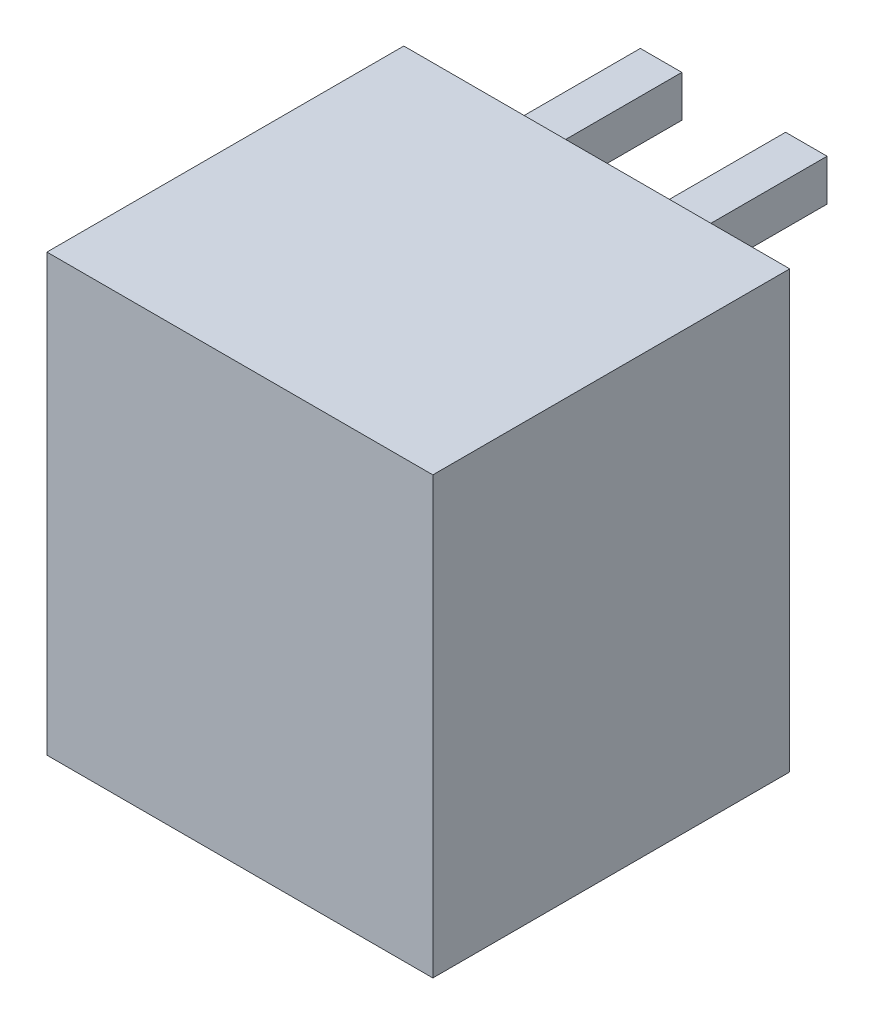
from build123d import *

# Parameters (mm, degrees)
SKETCH_1_W                         = 9.3
SKETCH_1_H                         = 10.5
EXTRUDE_1_DEPTH                    = 8.6
CUT_EXTRUDE_1_DEPTH                = 7
EXTRUDE_START                      = -5
SKETCH_3_W                         = 1
SKETCH_3_H                         = 1
EXTRUDE_2_DEPTH                    = 8.6
CHAMFER_1_SIZE                     = 0.3
PATTERN_LINEAR_1_COUNT             = 2
PATTERN_LINEAR_1_PITCH             = 3.5
CHAMFER_1_OF_PATTERN_LINEAR_1_SIZE = 0.3


with BuildPart() as part:
    # Эскиз1 → Бобышка-Вытянуть1 (new body)
    with BuildSketch(Plane.XY):
        Rectangle(SKETCH_1_W, SKETCH_1_H)
    extrude(amount=EXTRUDE_1_DEPTH)

    # Эскиз2 → Вырез-Вытянуть1 (cut)
    with BuildSketch(Plane.XZ.offset(5.25)):
        Polygon((-3.65, 6.6), (3.65, 6.6), (3.65, 0.2), (1.45, 0.2), (1.45, 1.8), (0.15, 1.8), (0.15, 0.2), (-2.05, 0.2), (-2.05, 1.8), (-3.65, 1.8), align=None)
    extrude(amount=-CUT_EXTRUDE_1_DEPTH, mode=Mode.SUBTRACT)

    # Эскиз3 → Бобышка-Вытянуть2 (add)
    with BuildSketch(Plane(origin=(0, 0, 0), x_dir=(-1, 0, 0), z_dir=(0, 0, -1)).offset(EXTRUDE_START)):
        with Locations((1.75, 4.25)):
            Rectangle(SKETCH_3_W, SKETCH_3_H)
    extrude_2 = extrude(amount=EXTRUDE_2_DEPTH)

    # Фаска1
    chamfer_1_edges = [part.edges().sort_by_distance(p)[0] for p in [
        (-1.25, 4.25, -3.6),
        (-1.75, 3.75, -3.6),
        (-2.25, 4.25, -3.6),
        (-1.75, 4.75, -3.6),
    ]]
    chamfer(chamfer_1_edges, length=CHAMFER_1_SIZE)

    # Линейный массив1: Бобышка-Вытянуть2 ×2
    with Locations(*[(i * PATTERN_LINEAR_1_PITCH, 0, 0) for i in range(1, PATTERN_LINEAR_1_COUNT)]):
        add(extrude_2)

    # Фаска1 of Линейный массив1
    chamfer_1_of_pattern_linear_1_edges = [part.edges().sort_by_distance(p)[0] for p in [
        (2.25, 4.25, -3.6),
        (1.75, 3.75, -3.6),
        (1.25, 4.25, -3.6),
        (1.75, 4.75, -3.6),
    ]]
    chamfer(chamfer_1_of_pattern_linear_1_edges, length=CHAMFER_1_OF_PATTERN_LINEAR_1_SIZE)


solid = part.part
